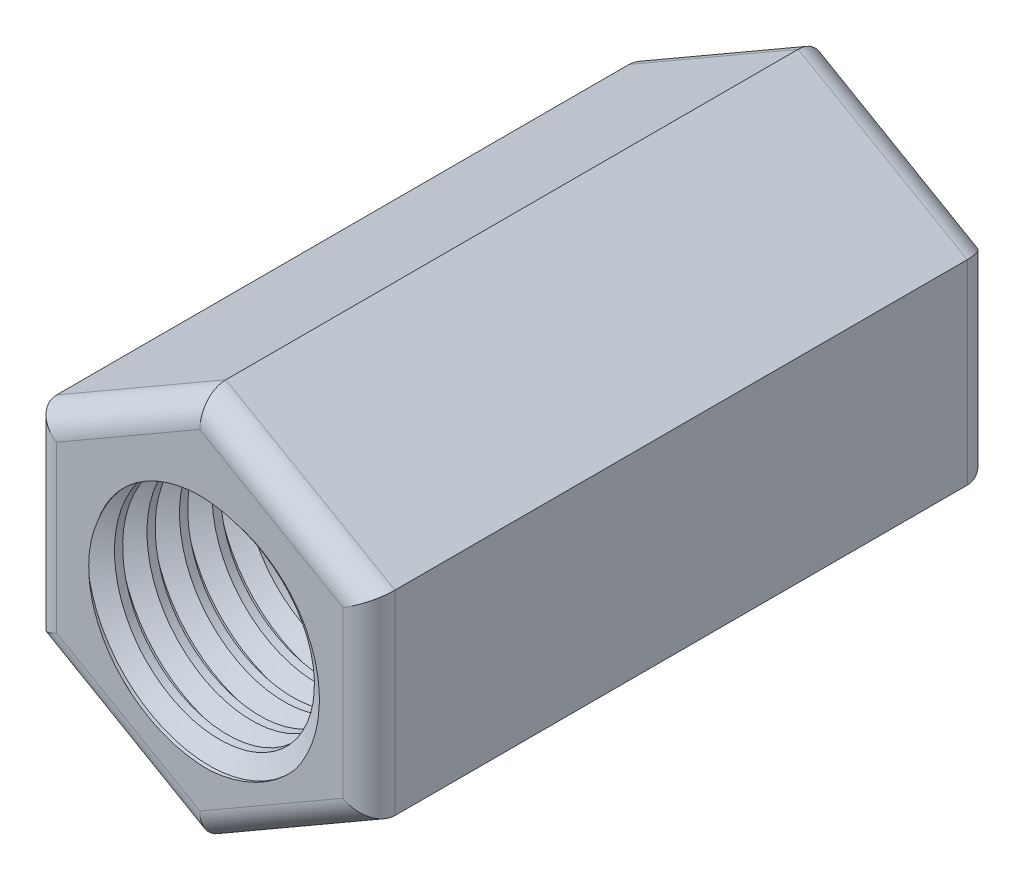
from build123d import *

# Parameters (mm, degrees)
EXTRUDE_1_DEPTH   = 24
HOLE_WIZARD_M81_D = 8.3
THREAD_1_PITCH    = 1.25
FILLET_1_R        = 1


with BuildPart() as part:
    # Sketch 1 → Бобышка-Вытянуть1 (new body)
    with BuildSketch(Plane.XY):
        Polygon((0, -7.505553499), (6.5, -3.75277675), (6.5, 3.75277675), (0, 7.505553499), (-6.5, 3.75277675), (-6.5, -3.75277675), align=None)
    extrude(amount=EXTRUDE_1_DEPTH)

    # Сверло под метчик  спиральное M81 (through all)
    with Locations(Plane(origin=(0, 0, 0), x_dir=(-1, 0, 0), z_dir=(0, 0, -1))):
        with Locations((0, 0)):
            Hole(HOLE_WIZARD_M81_D / 2)

    # Резьба1: the profile of Sketch 1 2 profile screwed along a right-hand helix of 19.2 turns, 8 arcs to a turn; built about Z, then put on its axis
    thread_1_z = Axis((0, 0, 0), (0, 0, 1))
    thread_1_corners = [(4.1497, 0, -0.000173205), (4.826582344, 0, 0.390624998), (4.826582344, 0, 0.546874998), (4.1497, 0, 0.937673202)]
    with BuildLine(mode=Mode.PRIVATE) as thread_1_profile:
        Line(thread_1_corners[0], thread_1_corners[1])
        Line(thread_1_corners[1], thread_1_corners[2])
        Line(thread_1_corners[2], thread_1_corners[3])
        Line(thread_1_corners[3], thread_1_corners[0])
    thread_1_cap = Face(thread_1_profile.wire())
    thread_1_turn_angles = [0, 22.5, 45, 67.5, 90, 112.5, 135, 157.5, 180, 202.5, 225, 247.5, 270, 292.5, 315, 337.5, 360]
    thread_1_turn_weights = [1, 0.9238795325112867, 1, 0.9238795325112867, 1, 0.9238795325112867, 1, 0.9238795325112867, 1, 0.9238795325112867, 1, 0.9238795325112867, 1, 0.9238795325112867, 1, 0.9238795325112867, 1]
    thread_1_turn_rails = [Edge.make_bspline([Vector(p[0], p[1], 0).rotate(thread_1_z, thread_1_turn_angles[k]) / thread_1_turn_weights[k] + Vector(0, 0, p[2] + THREAD_1_PITCH * thread_1_turn_angles[k] / 360) for k in range(17)], [0, 0, 0, 1, 1, 2, 2, 3, 3, 4, 4, 5, 5, 6, 6, 7, 7, 8, 8, 8], 2, thread_1_turn_weights) for p in thread_1_corners]
    thread_1_turn_sides = [Face.make_surface_from_curves(thread_1_turn_rails[p[0]], thread_1_turn_rails[p[1]]) for p in [(0, 1), (1, 2), (2, 3), (3, 0)]]
    thread_1_last_angles = [6840, 6862.5, 6885, 6898.5, 6912]
    thread_1_last_weights = [1, 0.9238795325112867, 1, 0.9723699203976766, 1]
    thread_1_last_rails = [Edge.make_bspline([Vector(p[0], p[1], 0).rotate(thread_1_z, thread_1_last_angles[k]) / thread_1_last_weights[k] + Vector(0, 0, p[2] + THREAD_1_PITCH * thread_1_last_angles[k] / 360) for k in range(5)], [0, 0, 0, 1, 1, 2, 2, 2], 2, thread_1_last_weights) for p in thread_1_corners]
    thread_1_last_sides = [Face.make_surface_from_curves(thread_1_last_rails[p[0]], thread_1_last_rails[p[1]]) for p in [(0, 1), (1, 2), (2, 3), (3, 0)]]
    thread_1 = Plane(origin=(0, 0, 0), x_dir=(1, 0, 0), z_dir=(0, 0, 1)) * Solid(Shell([*[p.moved(Location((0, 0, THREAD_1_PITCH * i))) for i in range(19) for p in thread_1_turn_sides], *thread_1_last_sides, thread_1_cap, thread_1_cap.rotate(thread_1_z, 6912).moved(Location((0, 0, THREAD_1_PITCH * 6912 / 360)))]))
    add(thread_1, mode=Mode.SUBTRACT)

    # Скругление1
    fillet_1_edges = [part.edges().sort_by_distance(p)[0] for p in [
        (6.5, 0, 24),
        (3.25, 5.629165125, 24),
        (-3.25, 5.629165125, 24),
        (-6.5, 0, 24),
        (-3.25, -5.629165125, 24),
        (-6.5, 0, 0),
        (-3.25, 5.629165125, 0),
        (3.25, 5.629165125, 0),
        (3.25, -5.629165125, 24),
        (6.5, 0, 0),
        (3.25, -5.629165125, 0),
        (-3.25, -5.629165125, 0),
    ]]
    fillet(fillet_1_edges, radius=FILLET_1_R)


solid = part.part
